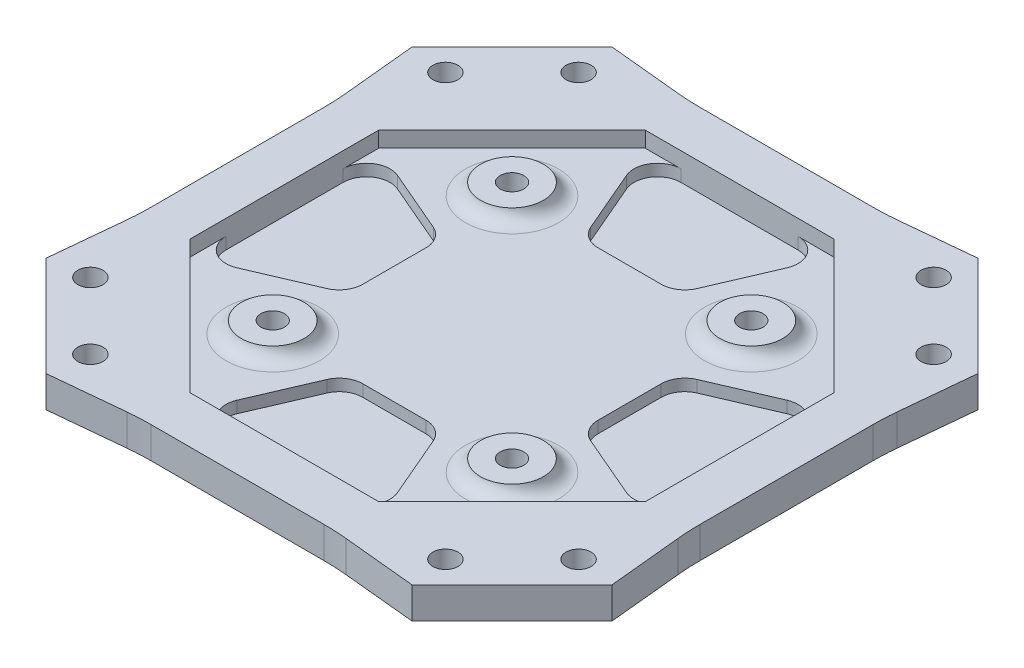
from build123d import *

# Parameters (mm, degrees)
SKETCH2_R           = 1.6
BOSS_EXTRUDE1_DEPTH = 4
CUT_EXTRUDE1_DEPTH  = 2
CUT_EXTRUDE2_DEPTH  = 1.5
SKETCH6_R           = 1.5
CUT_EXTRUDE3_DEPTH  = 52.039200621
BOSS_EXTRUDE4_START = 1.5
SKETCH7_R           = 4
SKETCH7_R_2         = 1.5
BOSS_EXTRUDE4_DEPTH = 1.5
CIRPATTERN1_COUNT   = 4
FILLET2_R           = 2
FILLET4_R           = 30


with BuildPart() as part:
    # Sketch2 → Boss-Extrude1 (new body)
    with BuildSketch(Plane(origin=(0, 0, 0), x_dir=(1, 0, 0), z_dir=(0, 1, 0))):
        Polygon((-12.5, 35), (12.5, 35), (23.334523779, 36.062445841), (36.062445841, 23.334523779), (35, 12.5), (35, -12.5), (36.062445841, -23.334523779), (23.334523779, -36.062445841), (12.5, -35), (-12.5, -35), (-23.334523779, -36.062445841), (-36.062445841, -23.334523779), (-35, -12.5), (-35, 12.5), (-36.062445841, 23.334523779), (-23.334523779, 36.062445841), align=None)
        with Locations(Location((22.627416998, 31.112698372, 0), (0, 0, 270))):
            Circle(SKETCH2_R, mode=Mode.SUBTRACT)
        with Locations(Location((31.112698372, 22.627416998, 0), (0, 0, 270))):
            Circle(SKETCH2_R, mode=Mode.SUBTRACT)
        with Locations(Location((22.627416998, -31.112698372, 0), (0, 0, 270))):
            Circle(SKETCH2_R, mode=Mode.SUBTRACT)
        with Locations(Location((31.112698372, -22.627416998, 0), (0, 0, 270))):
            Circle(SKETCH2_R, mode=Mode.SUBTRACT)
        with Locations(Location((-31.112698372, -22.627416998, 0), (0, 0, 270))):
            Circle(SKETCH2_R, mode=Mode.SUBTRACT)
        with Locations(Location((-22.627416998, -31.112698372, 0), (0, 0, 270))):
            Circle(SKETCH2_R, mode=Mode.SUBTRACT)
        with Locations(Location((-22.627416998, 31.112698372, 0), (0, 0, 270))):
            Circle(SKETCH2_R, mode=Mode.SUBTRACT)
        with Locations(Location((-31.112698372, 22.627416998, 0), (0, 0, 270))):
            Circle(SKETCH2_R, mode=Mode.SUBTRACT)
    extrude(amount=BOSS_EXTRUDE1_DEPTH)

    # Sketch4 → Cut-Extrude1 (cut)
    with BuildSketch(Plane(origin=(0, 4, 0), x_dir=(1, 0, 0), z_dir=(0, 1, 0))):
        Polygon((29, 12.012193309), (12.012193309, 29), (-12.012193309, 29), (-29, 12.012193309), (-29, -12.012193309), (-12.012193309, -29), (12.012193309, -29), (29, -12.012193309), align=None)
    extrude(amount=-CUT_EXTRUDE1_DEPTH, mode=Mode.SUBTRACT)

    # Sketch5 → Cut-Extrude2 (cut)
    with BuildSketch(Plane(origin=(0, 2, 0), x_dir=(1, 0, 0), z_dir=(0, 1, 0))):
        with BuildLine():
            Line((-24.816214135, 10.215498353), (-16.816214135, 6.779959319))
            ThreePointArc((-16.816214135, 6.779959319), (-15.494869505, 5.673946029), (-15, 4.023394242))
            Line((-15, 4.023394242), (-15, -4.023394242))
            ThreePointArc((-15, -4.023394242), (-15.494869505, -5.673946029), (-16.816214135, -6.779959319))
            Line((-16.816214135, -6.779959319), (-24.816214135, -10.215498353))
            ThreePointArc((-24.816214135, -10.215498353), (-27.650551787, -9.964063771), (-29, -7.458933276))
            Line((-29, -7.458933276), (-29, 7.458933276))
            ThreePointArc((-29, 7.458933276), (-27.650551787, 9.964063771), (-24.816214135, 10.215498353))
        make_face()
        with BuildLine():
            Line((10.215498353, 24.816214135), (6.779959319, 16.816214135))
            ThreePointArc((6.779959319, 16.816214135), (5.673946029, 15.494869505), (4.023394242, 15))
            Line((4.023394242, 15), (-4.023394242, 15))
            ThreePointArc((-4.023394242, 15), (-5.673946029, 15.494869505), (-6.779959319, 16.816214135))
            Line((-6.779959319, 16.816214135), (-10.215498353, 24.816214135))
            ThreePointArc((-10.215498353, 24.816214135), (-9.964063771, 27.650551787), (-7.458933276, 29))
            Line((-7.458933276, 29), (7.458933276, 29))
            ThreePointArc((7.458933276, 29), (9.964063771, 27.650551787), (10.215498353, 24.816214135))
        make_face()
        with BuildLine():
            Line((24.816214135, -10.215498353), (16.816214135, -6.779959319))
            ThreePointArc((16.816214135, -6.779959319), (15.494869505, -5.673946029), (15, -4.023394242))
            Line((15, -4.023394242), (15, 4.023394242))
            ThreePointArc((15, 4.023394242), (15.494869505, 5.673946029), (16.816214135, 6.779959319))
            Line((16.816214135, 6.779959319), (24.816214135, 10.215498353))
            ThreePointArc((24.816214135, 10.215498353), (27.650551787, 9.964063771), (29, 7.458933276))
            Line((29, 7.458933276), (29, -7.458933276))
            ThreePointArc((29, -7.458933276), (27.650551787, -9.964063771), (24.816214135, -10.215498353))
        make_face()
        with BuildLine():
            Line((-10.215498353, -24.816214135), (-6.779959319, -16.816214135))
            ThreePointArc((-6.779959319, -16.816214135), (-5.673946029, -15.494869505), (-4.023394242, -15))
            Line((-4.023394242, -15), (4.023394242, -15))
            ThreePointArc((4.023394242, -15), (5.673946029, -15.494869505), (6.779959319, -16.816214135))
            Line((6.779959319, -16.816214135), (10.215498353, -24.816214135))
            ThreePointArc((10.215498353, -24.816214135), (9.964063771, -27.650551787), (7.458933276, -29))
            Line((7.458933276, -29), (-7.458933276, -29))
            ThreePointArc((-7.458933276, -29), (-9.964063771, -27.650551787), (-10.215498353, -24.816214135))
        make_face()
    extrude(amount=-CUT_EXTRUDE2_DEPTH, mode=Mode.SUBTRACT)

    # Sketch6 → Cut-Extrude3 (cut, through all)
    with BuildSketch(Plane(origin=(0, 2, 0), x_dir=(1, 0, 0), z_dir=(0, 1, 0))):
        with Locations(Location((15.25, 15.25, 0), (0, 0, 270))):
            Circle(SKETCH6_R)
    cut_extrude3 = extrude(amount=-CUT_EXTRUDE3_DEPTH, mode=Mode.SUBTRACT)

    # Sketch7 → Boss-Extrude4 (add)
    with BuildSketch(Plane(origin=(0, 2, 0), x_dir=(1, 0, 0), z_dir=(0, 1, 0)).offset(BOSS_EXTRUDE4_START)):
        with Locations(Location((15.25, 15.25, 0), (0, 0, 270))):
            Circle(SKETCH7_R)
        with Locations(Location((15.25, 15.25, 0), (0, 0, 270))):
            Circle(SKETCH7_R_2, mode=Mode.SUBTRACT)
    boss_extrude4 = extrude(amount=-BOSS_EXTRUDE4_DEPTH)

    # CirPattern1: Cut-Extrude3, Boss-Extrude4 ×4 about axis
    cirpattern1_axis = Axis((0, 0, 0), (0, 1, 0))
    add([cut_extrude3.rotate(cirpattern1_axis, i * 360 / CIRPATTERN1_COUNT) for i in range(1, CIRPATTERN1_COUNT)], mode=Mode.SUBTRACT)
    add([boss_extrude4.rotate(cirpattern1_axis, i * 360 / CIRPATTERN1_COUNT) for i in range(1, CIRPATTERN1_COUNT)])

    # Fillet2
    # the kernel refuses this fillet: 2 mm, written as the material it adds along each edge
    with BuildSketch(Plane(origin=(15.25, 2, -15.25), x_dir=(0, 0, 1), z_dir=(-1, 0, 0))) as fillet2_piece_1:
        with BuildLine():
            CenterArc((5.936491673, 2), FILLET2_R, 194.477512186, 75.522487814)
            Line((4, 1.5), (3.961270167, 1.49))
            ThreePointArc((3.961270167, 1.49), (3.96, 0.75), (3.96, 0))
            Line((3.96, 0), (4, -0.04))
            Line((4, -0.04), (5.936491673, -0.04))
            Line((5.936491673, -0.04), (5.936491673, 0))
        make_face()
    revolve(axis=Axis((15.25, 2, -15.25), (0, 1, 0)))
    with BuildSketch(Plane(origin=(15.25, 2, 15.25), x_dir=(-1, 0, 0), z_dir=(0, 0, -1))) as fillet2_piece_2:
        with BuildLine():
            CenterArc((5.936491673, 2), FILLET2_R, 194.477512186, 75.522487814)
            Line((4, 1.5), (3.961270167, 1.49))
            ThreePointArc((3.961270167, 1.49), (3.96, 0.75), (3.96, 0))
            Line((3.96, 0), (4, -0.04))
            Line((4, -0.04), (5.936491673, -0.04))
            Line((5.936491673, -0.04), (5.936491673, 0))
        make_face()
    revolve(axis=Axis((15.25, 2, 15.25), (0, 1, 0)))
    with BuildSketch(Plane(origin=(-15.25, 2, 15.25), x_dir=(0, 0, -1), z_dir=(1, 0, 0))) as fillet2_piece_3:
        with BuildLine():
            CenterArc((5.936491673, 2), FILLET2_R, 194.477512186, 75.522487814)
            Line((4, 1.5), (3.961270167, 1.49))
            ThreePointArc((3.961270167, 1.49), (3.96, 0.75), (3.96, 0))
            Line((3.96, 0), (4, -0.04))
            Line((4, -0.04), (5.936491673, -0.04))
            Line((5.936491673, -0.04), (5.936491673, 0))
        make_face()
    revolve(axis=Axis((-15.25, 2, 15.25), (0, 1, 0)))
    with BuildSketch(Plane(origin=(-15.25, 2, -15.25), x_dir=(1, 0, 0), z_dir=(0, 0, 1))) as fillet2_piece_4:
        with BuildLine():
            CenterArc((5.936491673, 2), FILLET2_R, 194.477512186, 75.522487814)
            Line((4, 1.5), (3.961270167, 1.49))
            ThreePointArc((3.961270167, 1.49), (3.96, 0.75), (3.96, 0))
            Line((3.96, 0), (4, -0.04))
            Line((4, -0.04), (5.936491673, -0.04))
            Line((5.936491673, -0.04), (5.936491673, 0))
        make_face()
    revolve(axis=Axis((-15.25, 2, -15.25), (0, 1, 0)))

    # Fillet4
    # the kernel refuses this fillet: 30 mm, written as the material it adds along each edge
    with BuildSketch(Plane(origin=(35, 0, -12.5), x_dir=(0.09759304388629828, 0, -0.9952264052892723), z_dir=(0, 1, 0)), Plane(origin=(35, 0, 12.5), x_dir=(0, 0, -1), z_dir=(0, 1, 0)), Plane(origin=(12.5, 0, 35), x_dir=(0.9952264052892723, 0, 0.09759304388629875), z_dir=(0, 1, 0)), Plane(origin=(12.5, 0, -35), x_dir=(-1, 0, 0), z_dir=(0, 1, 0))) as fillet4_piece_1:
        with BuildLine():
            CenterArc((FILLET4_R * 0.0489132680019, -FILLET4_R), FILLET4_R, 90, 5.600584003)
            Line((-FILLET4_R * 0.0486797758844, -FILLET4_R * 0.00477359471073), (0, 0))
            Line((0, 0), (FILLET4_R * 0.0489132680019, 0))
        make_face()
    extrude(amount=4)
    with BuildSketch(Plane(origin=(-12.5, 0, 35), x_dir=(-0.9952264052892463, 0, 0.09759304388656506), z_dir=(0, 1, 0)), Plane(origin=(-35, 0, 12.5), x_dir=(0, 0, -1), z_dir=(0, 1, 0)), Plane(origin=(-35, 0, -12.5), x_dir=(-0.09759304388656435, 0, -0.9952264052892463), z_dir=(0, 1, 0)), Plane(origin=(-12.5, 0, -35), x_dir=(1, 0, 0), z_dir=(0, 1, 0))) as fillet4_piece_2:
        with BuildLine():
            CenterArc((FILLET4_R * 0.048913268002, FILLET4_R), FILLET4_R, 264.399415997, 5.600584003)
            Line((-FILLET4_R * 0.0486797758846, FILLET4_R * 0.00477359471075), (0, 0))
            Line((0, 0), (FILLET4_R * 0.048913268002, 0))
        make_face()
    extrude(amount=4)


solid = part.part
